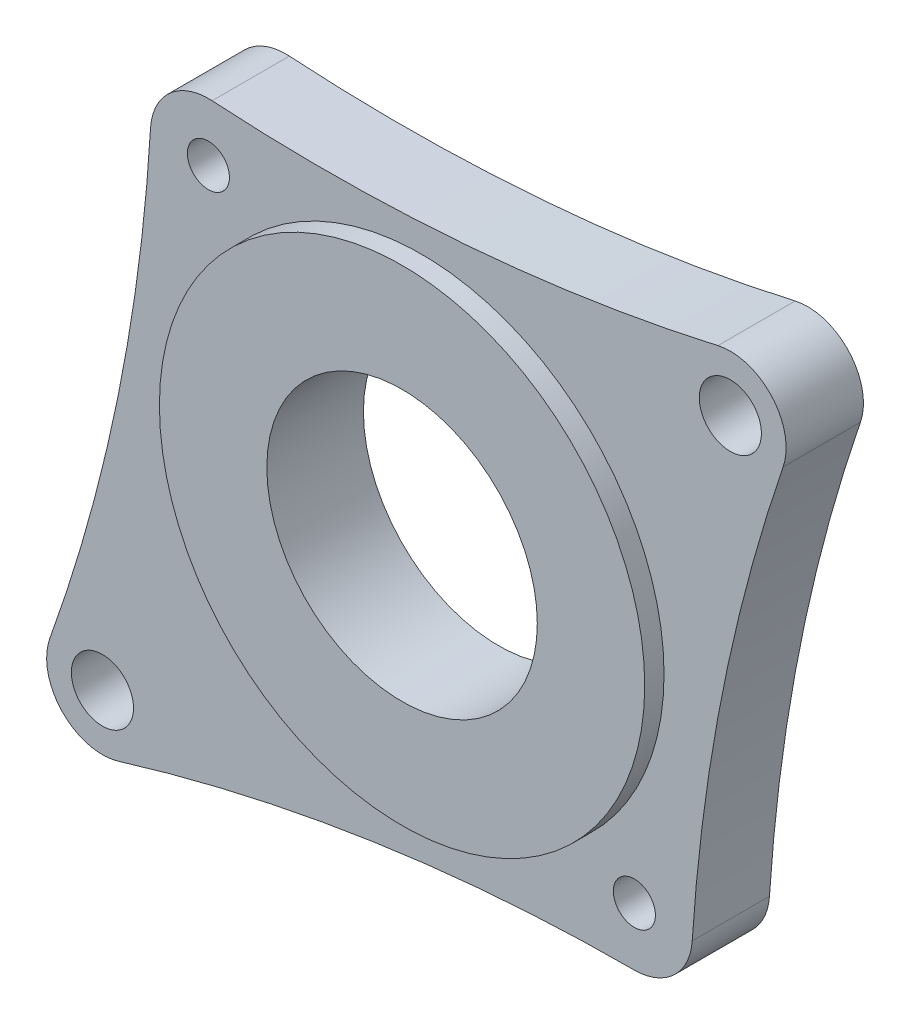
from build123d import *
from build123d.topology import SkipClean

# Parameters (mm, degrees)
BOSS_EXTRUDE1_DEPTH          = 6.35
F_7_8_0_875_DIAMETER_HOLE1_D = 22.225
F_10_CLEARANCE_HOLE1_D       = 5.1054
F_8_32_TAPPED_HOLE1_D        = 3.4544
SKETCH33_R                   = 19.939
SKETCH33_R_2                 = 11.1125
BOSS_EXTRUDE3_DEPTH          = 1.5875


with BuildPart() as part:
    # Sketch1 → Boss-Extrude1 (new body)
    with BuildSketch(Plane.XY):
        with BuildLine():
            ThreePointArc((29.724646249, 19.656342437), (28.792029634, 24.206107761), (24.36391271, 25.606792867))
            ThreePointArc((24.36391271, 25.606792867), (3.704744399, 22.428476482), (-17.196740725, 22.25283495))
            ThreePointArc((-17.196740725, 22.25283495), (-20.654876788, 21.06765451), (-22.254232731, 17.780494905))
            ThreePointArc((-22.254232731, 17.780494905), (-24.94278341, -2.733369886), (-30.522874393, -22.655958523))
            ThreePointArc((-30.522874393, -22.655958523), (-29.526294957, -27.367332021), (-24.868197962, -28.588947016))
            ThreePointArc((-24.868197962, -28.588947016), (-3.918964321, -23.852830981), (17.5, -22.2625))
            ThreePointArc((17.5, -22.2625), (20.756780188, -20.974879718), (22.252512093, -17.808277557))
            ThreePointArc((22.252512093, -17.808277557), (24.749635252, 1.17113371), (29.724646249, 19.656342437))
        make_face()
    extrude(amount=BOSS_EXTRUDE1_DEPTH)

    # 7/8 (0.875) Diameter Hole1 (through all)
    with Locations(Plane.XY.offset(6.35)):
        with Locations((0, 0)):
            Hole(F_7_8_0_875_DIAMETER_HOLE1_D / 2)

    # #10 Clearance Hole1 (through all)
    with Locations(Plane.XY.offset(6.35)):
        with Locations((25.385765971, 21.137420428), (-26.207516439, -24.204234926)):
            Hole(F_10_CLEARANCE_HOLE1_D / 2)

    # #8-32 Tapped Hole1 (through all)
    with Locations(Plane.XY.offset(6.35)):
        with Locations((17.5, -17.5), (-17.5, 17.5)):
            Hole(F_8_32_TAPPED_HOLE1_D / 2)

    # Sketch33 → Boss-Extrude3 (add)
    with SkipClean():  # the faces are left unmerged after this step: merging them gives an invalid solid
        with BuildSketch(Plane.XY.offset(6.35)):
            Circle(SKETCH33_R)
            Circle(SKETCH33_R_2, mode=Mode.SUBTRACT)
        extrude(amount=BOSS_EXTRUDE3_DEPTH)
    add(part.part.scale(1), mode=Mode.REPLACE)  # the faces are merged on a copy


solid = part.part
